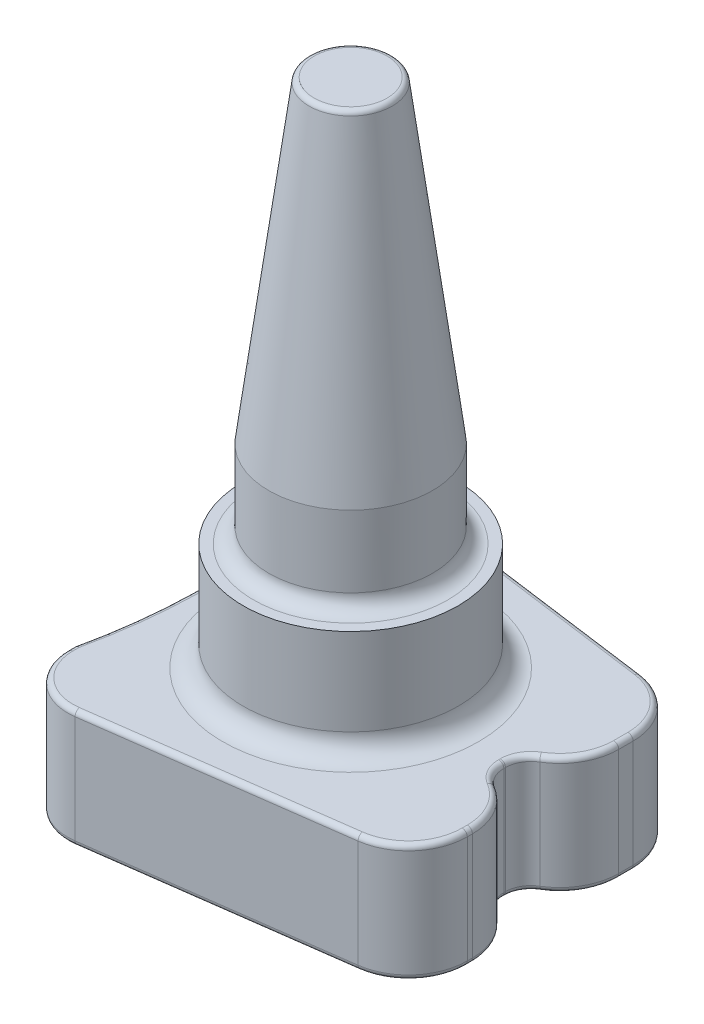
from build123d import *

# Parameters (mm, degrees)
ESBO_O2_OUTSIDE_W     = 213.508
ESBO_O2_OUTSIDE_H     = 213.508
CORTE_EXTRUS_O2_DEPTH = 177.104428981
ESBO_O3_R             = 106.5
CORTE_EXTRUS_O3_DEPTH = 140.951031327
FILETE1_R             = 10
ESBO_O4_W             = 8
ESBO_O4_H             = 4.25
CORTE_EXTRUS_O4_DEPTH = 140.587965081
FILETE2_R             = 11.5
FILETE3_R             = 11.5
FILETE4_R             = 5
FILETE5_R             = 5
FILETE6_R             = 11.5
FILETE7_R             = 4
FILETE8_R             = 3
FILETE9_R             = 1
FILETE10_R            = 1
ESBO_O5_R             = 20.5
CORTE_EXTRUS_O6_DEPTH = 2.5
CHANFRO1_SIZE         = 2
ESBO_O6_W             = 10
ESBO_O6_H             = 20
CORTE_EXTRUS_O7_DEPTH = 10
CHANFRO2_SIZE         = 1


with BuildPart() as part:
    # Esboço1 → Revolução1 (revolve)
    with BuildSketch(Plane.XY, mode=Mode.PRIVATE) as revolu_o1_sk:
        Polygon((17.384649235, 86.73567042), (25.384649235, 86.73567042), (33.384649235, 24.73567042), (33.384649235, 7.73567042), (38.384649235, 7.73567042), (38.384649235, -13.26432958), (97.384649235, -13.26432958), (97.384649235, -36.26432958), (17.384649235, -36.26432958), align=None)
    revolve(revolu_o1_sk.sketch.rotate(Axis((17.384649235, 86.73567042, 0), (0, -1, 0)), 180), axis=Axis((17.384649235, 86.73567042, 0), (0, -1, 0)))

    # Esboço2 outside → Corte-extrusão2 (cut, through all)
    with BuildSketch(Plane.XZ.offset(36.26432958)):
        with Locations((17.385, 0)):
            Rectangle(ESBO_O2_OUTSIDE_W, ESBO_O2_OUTSIDE_H)
        Polygon((56.384649235, 26.25), (56.384649235, -26.25), (-13.615350765, -35.75), (-13.615350765, 35.75), align=None, mode=Mode.SUBTRACT)
    extrude(amount=-CORTE_EXTRUS_O2_DEPTH, mode=Mode.SUBTRACT)

    # Esboço3 → Corte-extrusão3 (cut, through all)
    with BuildSketch(Plane.XZ.offset(36.26432958)):
        with Locations((-117.615350765, 0)):
            Circle(ESBO_O3_R)
    extrude(amount=-CORTE_EXTRUS_O3_DEPTH, mode=Mode.SUBTRACT)

    # Filete1
    filete1_edges = [part.edges().sort_by_distance(p)[0] for p in [
        (-13.615350765, -24.76432958, -35.75),
        (-13.615350765, -24.76432958, 35.75),
    ]]
    fillet(filete1_edges, radius=FILETE1_R)

    # Esboço4 → Corte-extrusão4 (cut, through all)
    with BuildSketch(Plane.XZ.offset(36.26432958)):
        with Locations((52.384649235, 2.125)):
            Rectangle(ESBO_O4_W, ESBO_O4_H)
        with Locations((52.384649235, -2.125)):
            Rectangle(ESBO_O4_W, ESBO_O4_H)
    extrude(amount=-CORTE_EXTRUS_O4_DEPTH, mode=Mode.SUBTRACT)

    # Filete2
    filete2_edges = [part.edges().sort_by_distance(p)[0] for p in [
        (56.384649235, -24.76432958, 26.25),
    ]]
    fillet(filete2_edges, radius=FILETE2_R)

    # Filete3
    # the kernel refuses this fillet: 11.5 mm, written as the material it takes off along each edge
    with BuildSketch(Plane(origin=(56.384649235, -63.650457456, 4.25), x_dir=(0, 0, 1), z_dir=(0, 1, 0))) as filete3_piece_1:
        with BuildLine():
            CenterArc((10.95445115, -11.5), FILETE3_R, 90, 72.281068127)
            Line((0, -8), (-0.219089023, -7.93))
            ThreePointArc((-0.219089023, -7.93), (-0.23, -4), (-0.23, 0))
            Line((-0.23, 0), (0, 0.23))
            Line((0, 0.23), (10.95445115, 0.23))
            Line((10.95445115, 0.23), (10.95445115, 0))
        make_face()
    extrude(amount=77.772255751, mode=Mode.SUBTRACT)

    # Filete4
    filete4_edges = [part.edges().sort_by_distance(p)[0] for p in [
        (48.384649235, -24.76432958, 4.25),
    ]]
    fillet(filete4_edges, radius=FILETE4_R)

    # Filete5
    filete5_edges = [part.edges().sort_by_distance(p)[0] for p in [
        (48.384649235, -24.76432958, -4.25),
    ]]
    fillet(filete5_edges, radius=FILETE5_R)

    # Filete6
    filete6_edges = [part.edges().sort_by_distance(p)[0] for p in [
        (56.384649235, -24.76432958, -26.25),
        (56.384649235, -24.76432958, -4.25),
    ]]
    fillet(filete6_edges, radius=FILETE6_R)

    # Filete7
    filete7_edges = [part.edges().sort_by_distance(p)[0] for p in [
        (38.384649235, -13.26432958, 0),
    ]]
    fillet(filete7_edges, radius=FILETE7_R)

    # Filete8
    filete8_edges = [part.edges().sort_by_distance(p)[0] for p in [
        (33.384649235, 7.73567042, 0),
    ]]
    fillet(filete8_edges, radius=FILETE8_R)

    # Filete9
    filete9_edges = [part.edges().sort_by_distance(p)[0] for p in [
        (49.032707836, -13.26432958, 3.524145346),
        (49.032707836, -13.26432958, -1.71182982),
        (56.384649235, -13.26432958, -14.798713755),
        (54.894114452, -13.26432958, -7.729927039),
        (53.545918618, -13.26432958, -23.770502568),
        (-13.615350765, -13.26432958, -23.620662492),
        (-11.115350765, -13.26432958, 0),
        (22.080325057, -13.26432958, -30.905586853),
        (-13.615350765, -13.26432958, 23.620662492),
        (-10.193794837, -13.26432958, 31.832724085),
        (-10.193794837, -13.26432958, -31.832724085),
        (22.080325057, -13.26432958, 30.905586853),
        (53.545918618, -13.26432958, 23.770502568),
        (56.384649235, -13.26432958, 15.704871518),
        (54.894114452, -13.26432958, 9.542242565),
        (25.384649235, 86.73567042, 0),
        (48.384649235, -13.26432958, 0.906157763),
    ]]
    fillet(filete9_edges, radius=FILETE9_R)

    # Filete10
    filete10_edges = [part.edges().sort_by_distance(p)[0] for p in [
        (54.894114452, -36.26432958, 9.542242565),
        (49.032707836, -36.26432958, 3.524145346),
        (56.384649235, -36.26432958, -14.798713755),
        (49.032707836, -36.26432958, -1.71182982),
        (54.894114452, -36.26432958, -7.729927039),
        (53.545918618, -36.26432958, -23.770502568),
        (-13.615350765, -36.26432958, -23.620662492),
        (-11.115350765, -36.26432958, 0),
        (-13.615350765, -36.26432958, 23.620662492),
        (22.080325057, -36.26432958, -30.905586853),
        (-10.193794837, -36.26432958, 31.832724085),
        (-10.193794837, -36.26432958, -31.832724085),
        (22.080325057, -36.26432958, 30.905586853),
        (53.545918618, -36.26432958, 23.770502568),
        (56.384649235, -36.26432958, 15.704871518),
        (48.384649235, -36.26432958, 0.906157763),
    ]]
    fillet(filete10_edges, radius=FILETE10_R)

    # Esboço5 → Corte-extrusão6 (cut)
    with BuildSketch(Plane.XZ.offset(36.26432958)):
        with Locations((18.634649235, 0.375)):
            Circle(ESBO_O5_R)
    extrude(amount=-CORTE_EXTRUS_O6_DEPTH, mode=Mode.SUBTRACT)

    # Chanfro1
    chanfro1_edges = [part.edges().sort_by_distance(p)[0] for p in [
        (-1.865350765, -33.76432958, 0.375),
    ]]
    chamfer(chanfro1_edges, length=CHANFRO1_SIZE)

    # Esboço6 → Corte-extrusão7 (cut)
    with BuildSketch(Plane.XZ.offset(33.76432958)):
        with Locations((18.634649235, 0.375)):
            Rectangle(ESBO_O6_W, ESBO_O6_H)
    extrude(amount=-CORTE_EXTRUS_O7_DEPTH, mode=Mode.SUBTRACT)

    # Chanfro2
    chanfro2_edges = [part.edges().sort_by_distance(p)[0] for p in [
        (13.634649235, -33.76432958, 0.375),
        (18.634649235, -33.76432958, -9.625),
        (23.634649235, -33.76432958, 0.375),
        (18.634649235, -33.76432958, 10.375),
    ]]
    chamfer(chanfro2_edges, length=CHANFRO2_SIZE)


solid = part.part
